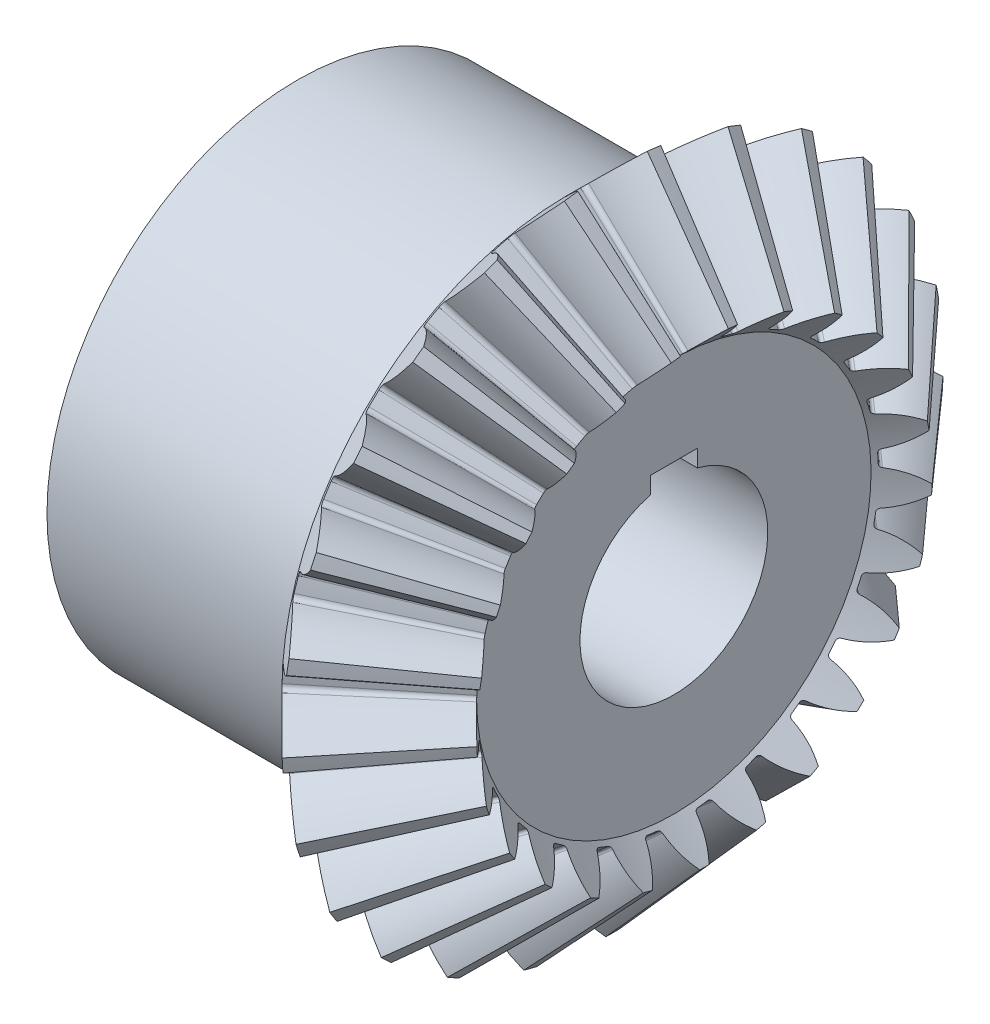
from build123d import *

# Parameters (mm, degrees)
TEETHCUTS_COUNT = 25
TEETHCUTS_ANGLE = 345.6
HUBSKE_R        = 25.4
HUB_DEPTH       = 27.463264251
BORSKE_R        = 9.525
BORE_DEPTH      = 61.9252508
KEYSKE_W        = 4.7625
KEYSKE_H        = 10.9474
KEYWAY_DEPTH    = 61.9252508


with BuildPart() as part:
    # BasProSke → Base-Revolve (revolve)
    with BuildSketch(Plane(origin=(0, 0, 0), x_dir=(1, 0, 0), z_dir=(0, 1, 0)), mode=Mode.PRIVATE) as base_revolve_sk:
        Polygon((0, 0), (0, 29.037962654), (4.508088577, 33.546051223), (13.8275703, 23.108969481), (10.722069726, 20.003468912), (10.722069726, 0), align=None)
    revolve(base_revolve_sk.sketch.rotate(Axis((-10, 0, 0), (1, 0, 0)), 180), axis=Axis((-10, 0, 0), (1, 0, 0)))

    # ToothCut: read off the stored shape, not the designer's step
    # ToothCut: loft between two sections, ruled curve by curve
    toothcut_from = [
        Edge.make_bspline([(34.468291125, 0.006253774, -0.009114269), (34.464006336, 0.001968985, -0.01499433), (34.458063818, -0.003973533, -0.014177676), (34.454659705, -0.007377646, -0.007240962)], [0, 0, 0, 0, 1, 1, 1, 1], 3, [1, 0.7646265, 0.7646265, 1]),
        Edge.make_bspline([(34.454659705, -0.007377646, 0.007240962), (34.458063818, -0.003973533, 0.014177676), (34.464006336, 0.001968985, 0.01499433), (34.468291125, 0.006253774, 0.009114269)], [0, 0, 0, 0, 1, 1, 1, 1], 3, [1, 0.7646265, 0.7646265, 1]),
        Edge.make_bspline([(34.454659705, -0.007377646, -0.007240962), (34.454150559, -0.007886792, -0.006203452), (34.453755649, -0.008281702, -0.005070765), (34.453483681, -0.00855367, -0.003867872)], [0, 0, 0, 0, 1, 1, 1, 1], 3, [1, 0.992651857, 0.992651857, 1]),
        Edge.make_bspline([(34.453483681, -0.00855367, 0.003867872), (34.453755649, -0.008281702, 0.005070765), (34.454150559, -0.007886792, 0.006203452), (34.454659705, -0.007377646, 0.007240962)], [0, 0, 0, 0, 1, 1, 1, 1], 3, [1, 0.992651857, 0.992651857, 1]),
        Edge.make_bspline([(34.453483681, -0.00855367, -0.003867872), (34.452910211, -0.00912714, -0.001331459), (34.452910211, -0.00912714, 0.001331459), (34.453483681, -0.00855367, 0.003867872)], [0, 0, 0, 0, 1, 1, 1, 1], 3, [1, 0.968329445, 0.968329445, 1]),
        Edge.make_line((34.468291125, 0.006253774, 0.009114269), (34.468291125, 0.006253774, -0.009114269)),
    ]
    toothcut_to = [
        Edge.make_bspline([(4.831198364, 33.869161009, -3.99453532), (3.677590917, 32.715553565, -2.607174416), (2.316944597, 31.354907247, -1.66713519), (0.834055777, 29.872018429, -1.233001504)], [0, 0, 0, 0, 1, 1, 1, 1], 3, [1, 0.979226448, 0.979226448, 1]),
        Edge.make_bspline([(0.834055777, 29.872018429, 1.233001504), (2.316944597, 31.354907247, 1.66713519), (3.677590917, 32.715553565, 2.607174416), (4.831198364, 33.869161009, 3.99453532)], [0, 0, 0, 0, 1, 1, 1, 1], 3, [1, 0.979226448, 0.979226448, 1]),
        Edge.make_bspline([(0.834055777, 29.872018429, -1.233001504), (0.649126277, 29.68708893, -1.17886115), (0.531692747, 29.5696554, -0.969701523), (0.536319621, 29.574282274, -0.702706764)], [0, 0, 0, 0, 1, 1, 1, 1], 3, [1, 0.845119662, 0.845119662, 1]),
        Edge.make_bspline([(0.536319621, 29.574282274, 0.702706764), (0.531692747, 29.5696554, 0.969701523), (0.649126277, 29.68708893, 1.17886115), (0.834055777, 29.872018429, 1.233001504)], [0, 0, 0, 0, 1, 1, 1, 1], 3, [1, 0.845119662, 0.845119662, 1]),
        Edge.make_bspline([(0.536319621, 29.574282274, -0.702706764), (0.544437159, 29.582399812, -0.234282472), (0.544437159, 29.582399812, 0.234282472), (0.536319621, 29.574282274, 0.702706764)], [0, 0, 0, 0, 1, 1, 1, 1], 3, [1, 0.999799883, 0.999799883, 1]),
        Edge.make_line((4.831198364, 33.869161009, 3.99453532), (4.831198364, 33.869161009, -3.99453532)),
    ]
    toothcut = Solid(Shell([*[Face.make_surface_from_curves(toothcut_from[k], toothcut_to[k]) for k in range(6)], Face(Wire(toothcut_from)), Face(Wire(toothcut_to))]))
    add(toothcut, mode=Mode.SUBTRACT)

    # TeethCuts: ToothCut ×25 about axis
    teethcuts_axis = Axis((-10, 0, 0), (1, 0, 0))
    for i in range(1, TEETHCUTS_COUNT):
        add(toothcut.rotate(teethcuts_axis, i * TEETHCUTS_ANGLE / (TEETHCUTS_COUNT - 1)), mode=Mode.SUBTRACT)

    # HubSke → Hub (add)
    with BuildSketch(Plane.ZY):
        with Locations(Location((0, 0, 0), (0, 0, 180))):
            Circle(HUBSKE_R)
    extrude(amount=HUB_DEPTH)

    # BorSke → Bore (cut, symmetric)
    with BuildSketch(Plane(origin=(0, 0, 0), x_dir=(0, 0, -1), z_dir=(1, 0, 0))):
        with Locations(Location((0, 0, 0), (0, 0, 180))):
            Circle(BORSKE_R)
    extrude(amount=BORE_DEPTH, both=True, mode=Mode.SUBTRACT)

    # KeySke → Keyway (cut, symmetric)
    with BuildSketch(Plane(origin=(0, 0, 0), x_dir=(0, 0, -1), z_dir=(1, 0, 0))):
        with Locations((0, 5.4737)):
            Rectangle(KEYSKE_W, KEYSKE_H)
    extrude(amount=KEYWAY_DEPTH, both=True, mode=Mode.SUBTRACT)


solid = part.part
